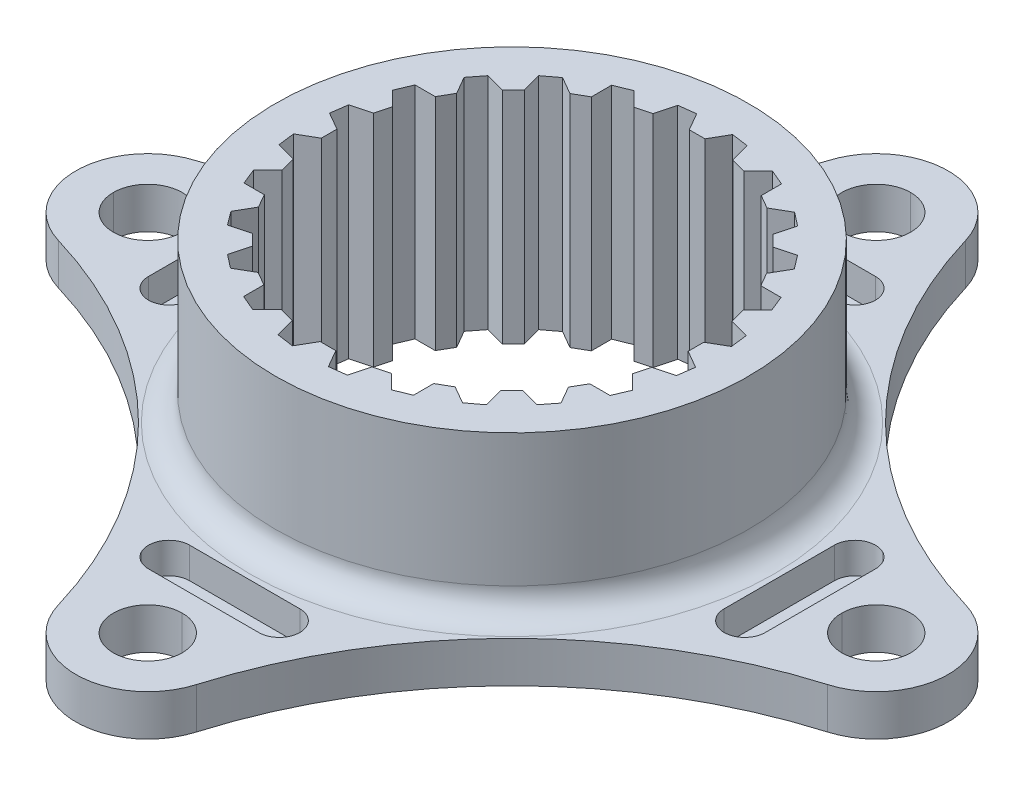
from build123d import *

# Parameters (mm, degrees)
SKETCH8_R                = 100
BOSS_EXTRUDE4_DEPTH      = 24.638
CUT_EXTRUDE1_DEPTH       = 144.551492657
SKETCH9_OUTSIDE_W        = 258.782
SKETCH9_OUTSIDE_H        = 258.782
SKETCH9_OUTSIDE_R        = 29.21
CUT_EXTRUDE3_DEPTH       = 19.558
CUT_EXTRUDE6_START       = -7.62
SKETCH11_R               = 100
CUT_EXTRUDE6_DEPTH       = 7.62
SKETCH10_R               = 4.2545
CUT_EXTRUDE7_DEPTH       = 7.62
FILLET2_R                = 3.175
CUT_EXTRUDE12_DEPTH      = 3.81
FILLET5_R                = 2.54
CIRPATTERN1_COUNT        = 4
FILLET5_OF_CIRPATTERN1_R = 2.54
SKETCH14_R               = 29.0322
BOSS_EXTRUDE5_DEPTH      = 2.54
CUT_EXTRUDE17_DEPTH      = 2.54
CHAMFER1_SIZE            = 0.508


with BuildPart() as part:
    # Sketch8 → Boss-Extrude4 (new body)
    with BuildSketch(Plane(origin=(0, 0, 0), x_dir=(1, 0, 0), z_dir=(0, 1, 0))):
        with Locations(Location((0, 0, 0), (0, 0, 90))):
            Circle(SKETCH8_R)
    extrude(amount=BOSS_EXTRUDE4_DEPTH)

    # Sketch6 → Cut-Extrude1 (cut, through all)
    with BuildSketch(Plane(origin=(0, 0, 0), x_dir=(1, 0, 0), z_dir=(0, 1, 0))):
        Polygon((-0.9689411, -22.736267788), (0.9689411, -22.736267788), (2.2189411, -24.901331298), (4.303288018, -24.645405677), (4.950335631, -22.230591111), (6.822186096, -21.72903029), (8.589953049, -23.496797243), (10.537039143, -22.710123397), (10.537039143, -20.210123397), (12.215294358, -19.241182297), (14.380357867, -20.491182297), (16.057492438, -19.227370749), (15.410444825, -16.812556183), (16.78073447, -15.442266539), (19.195549035, -16.089314151), (20.488438134, -14.434491569), (19.238438134, -12.269428059), (20.207379233, -10.591172845), (22.707379233, -10.591172845), (23.527914603, -8.658112653), (21.76014765, -6.8903457), (22.261708471, -5.018495235), (24.676523036, -4.371447622), (24.968786548, -2.291884678), (22.803723039, -1.041884678), (22.803723039, 0.895997521), (24.968786548, 2.145997521), (24.712860927, 4.23034444), (22.298046362, 4.877392053), (21.796485541, 6.749242517), (23.564252494, 8.51700947), (22.777578648, 10.464095565), (20.277578648, 10.464095565), (19.308637548, 12.142350779), (20.558637548, 14.307414289), (19.294826, 15.98454886), (16.880011434, 15.337501247), (15.509721789, 16.707790891), (16.156769402, 19.122605457), (14.50194682, 20.415494555), (12.33688331, 19.165494555), (10.658628096, 20.134435655), (10.658628096, 22.634435655), (8.725567904, 23.454971025), (6.957800951, 21.687204072), (5.085950486, 22.188764892), (4.438902873, 24.603579458), (2.359339929, 24.89584297), (1.109339929, 22.730779461), (-0.828542271, 22.730779461), (-2.078542271, 24.89584297), (-4.162889189, 24.639917349), (-4.809936802, 22.225102783), (-6.681787267, 21.723541963), (-8.44955422, 23.491308916), (-10.396640314, 22.70463507), (-10.396640314, 20.20463507), (-12.074895529, 19.23569397), (-14.239959038, 20.48569397), (-15.917093609, 19.221882421), (-15.270045996, 16.807067856), (-16.640335641, 15.436778211), (-19.055150206, 16.083825824), (-20.348039305, 14.429003241), (-19.098039305, 12.263939732), (-20.066980404, 10.585684518), (-22.566980404, 10.585684518), (-23.387515774, 8.652624325), (-21.619748821, 6.884857372), (-22.121309642, 5.013006908), (-24.536124207, 4.365959295), (-24.828387719, 2.28639635), (-22.66332421, 1.03639635), (-22.66332421, -0.901485849), (-24.828387719, -2.151485849), (-24.572462098, -4.235832767), (-22.157647532, -4.88288038), (-21.656086712, -6.754730845), (-23.423853665, -8.522497798), (-22.637179819, -10.469583893), (-20.137179819, -10.469583893), (-19.168238719, -12.147839107), (-20.418238719, -14.312902616), (-19.154427171, -15.990037187), (-16.739612605, -15.342989575), (-15.36932296, -16.713279219), (-16.016370573, -19.128093785), (-14.361547991, -20.420982883), (-12.196484481, -19.170982883), (-10.518229267, -20.139923983), (-10.518229267, -22.639923983), (-8.585169075, -23.460459352), (-6.817402122, -21.6926924), (-4.945551657, -22.19425322), (-4.298504044, -24.609067786), (-2.2189411, -24.901331298), align=None)
    extrude(amount=CUT_EXTRUDE1_DEPTH, mode=Mode.SUBTRACT)

    # Sketch9 outside → Cut-Extrude3 (cut)
    with BuildSketch(Plane(origin=(0, 24.638, 0), x_dir=(1, 0, 0), z_dir=(0, 1, 0))):
        Rectangle(SKETCH9_OUTSIDE_W, SKETCH9_OUTSIDE_H)
        with Locations(Location((0, 0, 0), (0, 0, 270))):
            Circle(SKETCH9_OUTSIDE_R, mode=Mode.SUBTRACT)
    extrude(amount=-CUT_EXTRUDE3_DEPTH, mode=Mode.SUBTRACT)

    # Sketch11 → Cut-Extrude6 (cut)
    with BuildSketch(Plane(origin=(0, 5.08, 0), x_dir=(1, 0, 0), z_dir=(0, 1, 0)).offset(CUT_EXTRUDE6_START)):
        Circle(SKETCH11_R)
        with BuildLine():
            ThreePointArc((47.524896414, 8.523907443), (52.123146395, 5.319105699), (53.89, 0))
            ThreePointArc((53.89, 0), (52.123146395, -5.319105699), (47.524896414, -8.523907443))
            ThreePointArc((47.524896414, -8.523907443), (23.071907239, -23.071907239), (8.523907443, -47.524896414))
            ThreePointArc((8.523907443, -47.524896414), (0, -53.89), (-8.523907443, -47.524896414))
            ThreePointArc((-8.523907443, -47.524896414), (-23.071907239, -23.071907239), (-47.524896414, -8.523907443))
            ThreePointArc((-47.524896414, -8.523907443), (-53.89, 0), (-47.524896414, 8.523907443))
            ThreePointArc((-47.524896414, 8.523907443), (-23.071907239, 23.071907239), (-8.523907443, 47.524896414))
            ThreePointArc((-8.523907443, 47.524896414), (0, 53.89), (8.523907443, 47.524896414))
            ThreePointArc((8.523907443, 47.524896414), (23.071907239, 23.071907239), (47.524896414, 8.523907443))
        make_face(mode=Mode.SUBTRACT)
    extrude(amount=CUT_EXTRUDE6_DEPTH, mode=Mode.SUBTRACT)

    # Sketch10 → Cut-Extrude7 (cut)
    with BuildSketch(Plane(origin=(0, 5.08, 0), x_dir=(1, 0, 0), z_dir=(0, 1, 0))):
        with Locations(Location((0, 45, 0), (0, 0, 270))):
            Circle(SKETCH10_R)
        with Locations(Location((45, 0, 0), (0, 0, 270))):
            Circle(SKETCH10_R)
        with Locations(Location((0, -45, 0), (0, 0, 270))):
            Circle(SKETCH10_R)
        with Locations(Location((-45, 0, 0), (0, 0, 270))):
            Circle(SKETCH10_R)
    extrude(amount=-CUT_EXTRUDE7_DEPTH, mode=Mode.SUBTRACT)

    # Fillet2
    fillet2_edges = [part.edges().sort_by_distance(p)[0] for p in [
        (0, 5.08, -29.21),
    ]]
    fillet(fillet2_edges, radius=FILLET2_R)

    # Sketch13 → Cut-Extrude12 (cut)
    with BuildSketch(Plane(origin=(0, 5.08, 0), x_dir=(1, 0, 0), z_dir=(0, 1, 0))):
        Polygon((-8.426157097, 38.1), (8.426157097, 38.1), (10.795, 33.02), (-10.795, 33.02), align=None)
    cut_extrude12 = extrude(amount=-CUT_EXTRUDE12_DEPTH, mode=Mode.SUBTRACT)

    # Fillet5
    fillet5_edges = [part.edges().sort_by_distance(p)[0] for p in [
        (-10.795, 3.175, -33.02),
        (10.795, 3.175, -33.02),
        (-8.426157097, 3.175, -38.1),
        (8.426157097, 3.175, -38.1),
    ]]
    fillet(fillet5_edges, radius=FILLET5_R - 0.0001)  # a hair under: the kernel refuses the full size

    # CirPattern1: Cut-Extrude12 ×4 about axis
    cirpattern1_axis = Axis((0, 0, 0), (0, 1, 0))
    for i in range(1, CIRPATTERN1_COUNT):
        add(cut_extrude12.rotate(cirpattern1_axis, i * 360 / CIRPATTERN1_COUNT), mode=Mode.SUBTRACT)

    # Fillet5 of CirPattern1
    fillet5_of_cirpattern1_edges = [part.edges().sort_by_distance(p)[0] for p in [
        (-33.02, 3.175, 10.795),
        (-33.02, 3.175, -10.795),
        (-38.1, 3.175, 8.426157097),
        (-38.1, 3.175, -8.426157097),
        (10.795, 3.175, 33.02),
        (-10.795, 3.175, 33.02),
        (8.426157097, 3.175, 38.1),
        (-8.426157097, 3.175, 38.1),
        (33.02, 3.175, -10.795),
        (33.02, 3.175, 10.795),
        (38.1, 3.175, -8.426157097),
        (38.1, 3.175, 8.426157097),
    ]]
    fillet(fillet5_of_cirpattern1_edges, radius=FILLET5_OF_CIRPATTERN1_R - 0.0001)  # a hair under: the kernel refuses the full size

    # Sketch14 → Boss-Extrude5 (add)
    with BuildSketch(Plane.XZ):
        with Locations(Location((0, 0, 0), (0, 0, 90))):
            Circle(SKETCH14_R)
    extrude(amount=BOSS_EXTRUDE5_DEPTH)

    # Sketch6<5> → Cut-Extrude17 (cut)
    with BuildSketch(Plane(origin=(0, 0, 0), x_dir=(1, 0, 0), z_dir=(0, 1, 0))):
        Polygon((-0.9689411, -22.736267788), (0.9689411, -22.736267788), (2.2189411, -24.901331298), (4.303288018, -24.645405677), (4.950335631, -22.230591111), (6.822186096, -21.72903029), (8.589953049, -23.496797243), (10.537039143, -22.710123397), (10.537039143, -20.210123397), (12.215294358, -19.241182297), (14.380357867, -20.491182297), (16.057492438, -19.227370749), (15.410444825, -16.812556183), (16.78073447, -15.442266539), (19.195549035, -16.089314151), (20.488438134, -14.434491569), (19.238438134, -12.269428059), (20.207379233, -10.591172845), (22.707379233, -10.591172845), (23.527914603, -8.658112653), (21.76014765, -6.8903457), (22.261708471, -5.018495235), (24.676523036, -4.371447622), (24.968786548, -2.291884678), (22.803723039, -1.041884678), (22.803723039, 0.895997521), (24.968786548, 2.145997521), (24.712860927, 4.23034444), (22.298046362, 4.877392053), (21.796485541, 6.749242517), (23.564252494, 8.51700947), (22.777578648, 10.464095565), (20.277578648, 10.464095565), (19.308637548, 12.142350779), (20.558637548, 14.307414289), (19.294826, 15.98454886), (16.880011434, 15.337501247), (15.509721789, 16.707790891), (16.156769402, 19.122605457), (14.50194682, 20.415494555), (12.33688331, 19.165494555), (10.658628096, 20.134435655), (10.658628096, 22.634435655), (8.725567904, 23.454971025), (6.957800951, 21.687204072), (5.085950486, 22.188764892), (4.438902873, 24.603579458), (2.359339929, 24.89584297), (1.109339929, 22.730779461), (-0.828542271, 22.730779461), (-2.078542271, 24.89584297), (-4.162889189, 24.639917349), (-4.809936802, 22.225102783), (-6.681787267, 21.723541963), (-8.44955422, 23.491308916), (-10.396640314, 22.70463507), (-10.396640314, 20.20463507), (-12.074895529, 19.23569397), (-14.239959038, 20.48569397), (-15.917093609, 19.221882421), (-15.270045996, 16.807067856), (-16.640335641, 15.436778211), (-19.055150206, 16.083825824), (-20.348039305, 14.429003241), (-19.098039305, 12.263939732), (-20.066980404, 10.585684518), (-22.566980404, 10.585684518), (-23.387515774, 8.652624325), (-21.619748821, 6.884857372), (-22.121309642, 5.013006908), (-24.536124207, 4.365959295), (-24.828387719, 2.28639635), (-22.66332421, 1.03639635), (-22.66332421, -0.901485849), (-24.828387719, -2.151485849), (-24.572462098, -4.235832767), (-22.157647532, -4.88288038), (-21.656086712, -6.754730845), (-23.423853665, -8.522497798), (-22.637179819, -10.469583893), (-20.137179819, -10.469583893), (-19.168238719, -12.147839107), (-20.418238719, -14.312902616), (-19.154427171, -15.990037187), (-16.739612605, -15.342989575), (-15.36932296, -16.713279219), (-16.016370573, -19.128093785), (-14.361547991, -20.420982883), (-12.196484481, -19.170982883), (-10.518229267, -20.139923983), (-10.518229267, -22.639923983), (-8.585169075, -23.460459352), (-6.817402122, -21.6926924), (-4.945551657, -22.19425322), (-4.298504044, -24.609067786), (-2.2189411, -24.901331298), align=None)
    extrude(amount=-CUT_EXTRUDE17_DEPTH, mode=Mode.SUBTRACT)

    # Chamfer1
    chamfer1_edges = [part.edges().sort_by_distance(p)[0] for p in [
        (0, -2.54, -29.0322),
    ]]
    chamfer(chamfer1_edges, length=CHAMFER1_SIZE)


solid = part.part
